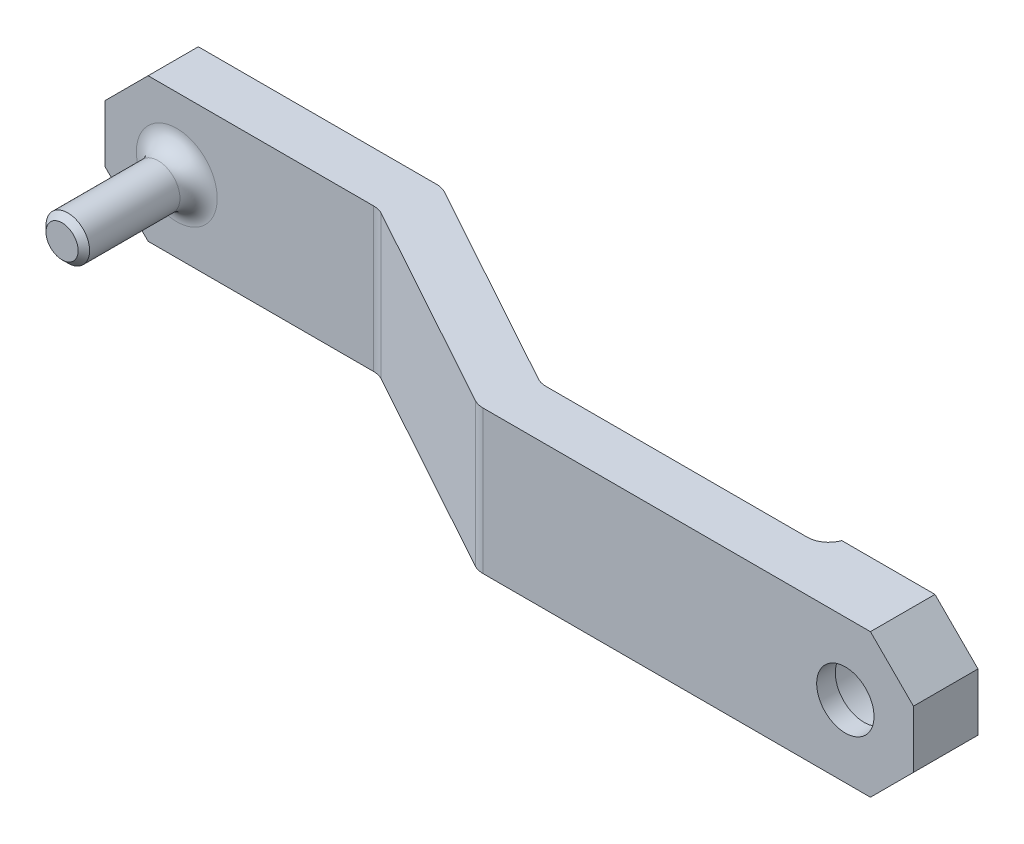
from build123d import *

# Parameters (mm, degrees)
BOSS_EXTRUDE1_DEPTH = 12.7
SKETCH2_R           = 4.1021
CUT_EXTRUDE1_DEPTH  = 4.064
SKETCH3_R           = 2.54
CUT_EXTRUDE2_DEPTH  = 85.28690538
SKETCH4_R           = 1.9304
BOSS_EXTRUDE2_DEPTH = 10.16
FILLET1_R           = 1.651
CHAMFER1_SIZE       = 3.81
FILLET2_R           = 1.905
CHAMFER2_SIZE       = 0.635
CHAMFER3_SIZE       = 0.508


with BuildPart() as part:
    # Sketch1 → Boss-Extrude1 (new body)
    with BuildSketch(Plane(origin=(0, 0, 0), x_dir=(1, 0, 0), z_dir=(0, 1, 0))):
        Polygon((0, 0), (0, -4.445), (24.258236459, -4.445), (43.625736459, -15.0975), (82.2325, -15.0975), (82.2325, -9.3825), (70.1675, -9.3825), (70.1675, -10.6525), (44.7675, -10.6525), (25.4, 0), align=None)
    extrude(amount=BOSS_EXTRUDE1_DEPTH)

    # Sketch2 → Cut-Extrude1 (cut)
    with BuildSketch(Plane(origin=(0, 0, 9.3825), x_dir=(-1, 0, 0), z_dir=(0, 0, -1))):
        with Locations((-76.2, 6.35)):
            Circle(SKETCH2_R)
    extrude(amount=-CUT_EXTRUDE1_DEPTH, mode=Mode.SUBTRACT)

    # Sketch3 → Cut-Extrude2 (cut, through all)
    with BuildSketch(Plane(origin=(0, 0, 13.4465), x_dir=(-1, 0, 0), z_dir=(0, 0, -1))):
        with Locations((-76.2, 6.35)):
            Circle(SKETCH3_R)
    extrude(amount=-CUT_EXTRUDE2_DEPTH, mode=Mode.SUBTRACT)

    # Sketch4 → Boss-Extrude2 (add)
    with BuildSketch(Plane(origin=(0, 0, 4.445), x_dir=(-1, 0, 0), z_dir=(0, 0, -1))):
        with Locations((-6.35, 6.35)):
            Circle(SKETCH4_R)
    extrude(amount=-BOSS_EXTRUDE2_DEPTH)

    # Fillet1
    fillet1_edges = [part.edges().sort_by_distance(p)[0] for p in [
        (8.2804, 6.35, 4.445),
    ]]
    fillet(fillet1_edges, radius=FILLET1_R)

    # Chamfer1
    chamfer1_edges = [part.edges().sort_by_distance(p)[0] for p in [
        (82.2325, 0, 12.24),
        (0, 0, 2.2225),
        (82.2325, 12.7, 12.24),
        (0, 12.7, 2.2225),
    ]]
    chamfer(chamfer1_edges, length=CHAMFER1_SIZE)

    # Fillet2
    # the kernel refuses this fillet: 1.905 mm, written as the material it adds along each edge
    with BuildSketch(Plane(origin=(24.258236459, 0, 4.445), x_dir=(-1, 0, 0), z_dir=(0, 1, 0))) as fillet2_piece_1:
        with BuildLine():
            CenterArc((FILLET2_R * 0.256864688635, FILLET2_R), FILLET2_R, 241.188354533, 28.811645467)
            Line((-FILLET2_R * 0.225067086378, FILLET2_R * 0.123791255332), (0, 0))
            Line((0, 0), (FILLET2_R * 0.256864688635, 0))
        make_face()
    extrude(amount=12.7)
    with BuildSketch(Plane(origin=(44.7675, 0, 10.6525), x_dir=(-0.8762087446678116, 0, -0.4819317750134946), z_dir=(0, 1, 0))) as fillet2_piece_2:
        with BuildLine():
            CenterArc((FILLET2_R * 0.256864688635, -FILLET2_R), FILLET2_R, 90, 28.811645467)
            Line((-FILLET2_R * 0.225067086378, -FILLET2_R * 0.123791255332), (0, 0))
            Line((0, 0), (FILLET2_R * 0.256864688635, 0))
        make_face()
    extrude(amount=12.7)
    with BuildSketch(Plane(origin=(70.1675, 0, 10.6525), x_dir=(-1, 0, 0), z_dir=(0, 1, 0))) as fillet2_piece_3:
        with BuildLine():
            CenterArc((1.796051224, -1.905), FILLET2_R, 90, 70.528779366)
            Line((0, -1.27), (0, 0))
            Line((0, 0), (1.796051224, 0))
        make_face()
    extrude(amount=12.7)
    # the kernel refuses this fillet: 1.905 mm, written as the material it takes off along each edge
    with BuildSketch(Plane(origin=(43.625736459, -1.22331808, 15.0975), x_dir=(-0.8762087446678133, 0, -0.4819317750134918), z_dir=(0, 1, 0))) as fillet2_2_piece_1:
        with BuildLine():
            CenterArc((FILLET2_R * 0.256864688635, -FILLET2_R), FILLET2_R, 90, 28.811645467)
            Line((-FILLET2_R * 0.225067086378, -FILLET2_R * 0.123791255332), (0, 0))
            Line((0, 0), (FILLET2_R * 0.256864688635, 0))
        make_face()
    extrude(amount=15.146636159, mode=Mode.SUBTRACT)
    with BuildSketch(Plane(origin=(25.4, -1.22331808, 0), x_dir=(-1, 0, 0), z_dir=(0, 1, 0))) as fillet2_2_piece_2:
        with BuildLine():
            CenterArc((FILLET2_R * 0.256864688635, FILLET2_R), FILLET2_R, 241.188354533, 28.811645467)
            Line((-FILLET2_R * 0.225067086378, FILLET2_R * 0.123791255332), (0, 0))
            Line((0, 0), (FILLET2_R * 0.256864688635, 0))
        make_face()
    extrude(amount=15.146636159, mode=Mode.SUBTRACT)

    # Chamfer2
    chamfer2_edges = [part.edges().sort_by_distance(p)[0] for p in [
        (80.3021, 6.35, 9.3825),
    ]]
    chamfer(chamfer2_edges, length=CHAMFER2_SIZE)

    # Chamfer3
    chamfer3_edges = [part.edges().sort_by_distance(p)[0] for p in [
        (8.2804, 6.35, 14.605),
    ]]
    chamfer(chamfer3_edges, length=CHAMFER3_SIZE)


solid = part.part
